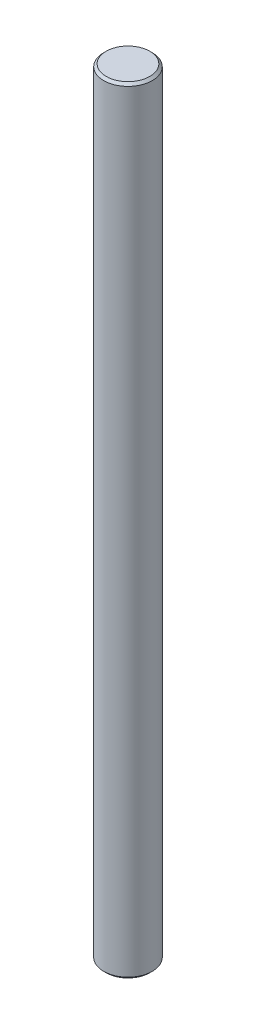
from build123d import *

# Parameters (mm, degrees)
SKETCH1_R           = 2.5
BOSS_EXTRUDE1_DEPTH = 40
CHAMFER1_SIZE       = 0.25


with BuildPart() as part:
    # Sketch1 → Boss-Extrude1 (new, symmetric)
    with BuildSketch(Plane(origin=(0, 0, 0), x_dir=(1, 0, 0), z_dir=(0, 1, 0))):
        Circle(SKETCH1_R)
    extrude(amount=BOSS_EXTRUDE1_DEPTH, both=True)

    # Chamfer1
    chamfer1_edges = [part.edges().sort_by_distance(p)[0] for p in [
        (-2.5, -40, 0),
        (-2.5, 40, 0),
    ]]
    chamfer(chamfer1_edges, length=CHAMFER1_SIZE)


solid = part.part
